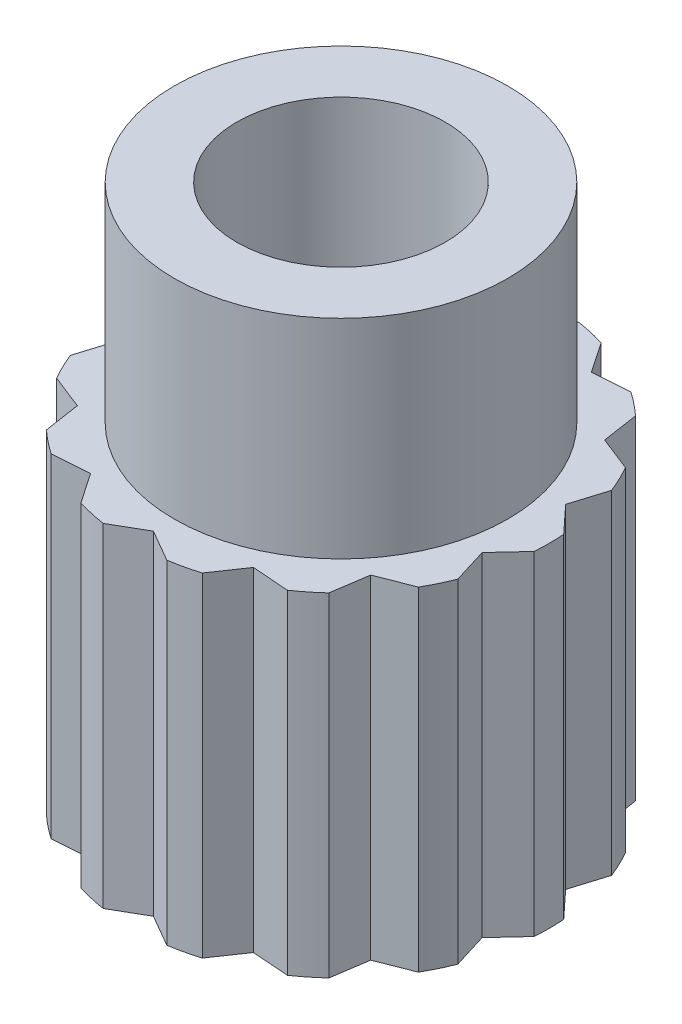
from build123d import *

# Parameters (mm, degrees)
MAINBODYS_R           = 2.5
MAIN_BODY_DEPTH       = 2
M3X0_5_TAPPED_HOLE1_D = 2.5
GROOVED_CUT_DEPTH     = 6.338539126
GC_START              = -2
GC_CP_DEPTH           = 4
PRESSFITBODYS_R       = 2
PRESSFITBODYS_R_2     = 1.25
PRESS_FIT_BODY_DEPTH  = 2.5


# Read off the part's stored shape, not the designer's step: GC CP
with BuildPart() as part:
    # MainBodyS → MAIN BODY (new, symmetric)
    with BuildSketch(Plane(origin=(0, 0, 0), x_dir=(1, 0, 0), z_dir=(0, 1, 0))):
        with Locations(Location((0, 0, 0), (0, 0, 270))):
            Circle(MAINBODYS_R)
    extrude(amount=MAIN_BODY_DEPTH, both=True)

    # M3x0.5 Tapped Hole1 (through all)
    with Locations(Plane(origin=(0, 2, 0), x_dir=(1, 0, 0), z_dir=(0, 1, 0))):
        with Locations((0, 0)):
            Hole(M3X0_5_TAPPED_HOLE1_D / 2)

    # GroovedCutS → GROOVED CUT (cut, through all)
    with BuildSketch(Plane(origin=(0, 2, 0), x_dir=(1, 0, 0), z_dir=(0, 1, 0))):
        with BuildLine():
            Line((0, 2.25), (0.382129822, 2.470622755))
            ThreePointArc((0.382129822, 2.470622755), (0, 2.5), (-0.382129822, 2.470622755))
            Line((-0.382129822, 2.470622755), (0, 2.25))
        make_face()
    extrude(amount=-GROOVED_CUT_DEPTH, mode=Mode.SUBTRACT)

    # GC CP outline → GC CP (cut)
    with BuildSketch(Plane(origin=(0, 0, 0), x_dir=(1, 0, 0), z_dir=(0, 1, 0)).offset(GC_START)):
        with BuildLine():
            ThreePointArc((-0.727675966, 2.391754103), (-1.084709348, 2.25242217), (-1.416250112, 2.060154271))
            Line((-1.416250112, 2.060154271), (-0.976238413, 2.027179953))
            Line((-0.976238413, 2.027179953), (-0.727675966, 2.391754103))
        make_face()
        with BuildLine():
            Line((0.976238413, 2.027179953), (1.416250112, 2.060154271))
            ThreePointArc((1.416250112, 2.060154271), (1.084709348, 2.25242217), (0.727675966, 2.391754103))
            Line((0.727675966, 2.391754103), (0.976238413, 2.027179953))
        make_face()
        with BuildLine():
            Line((1.759120836, 1.402852054), (2.169864698, 1.241646967))
            ThreePointArc((2.169864698, 1.241646967), (1.954578706, 1.558724504), (1.693356605, 1.839169217))
            Line((1.693356605, 1.839169217), (1.759120836, 1.402852054))
        make_face()
        with BuildLine():
            Line((2.193587802, 0.500672101), (2.493710969, 0.177216254))
            ThreePointArc((2.493710969, 0.177216254), (2.43731978, 0.556302335), (2.3236472, 0.922314312))
            Line((2.3236472, 0.922314312), (2.193587802, 0.500672101))
        make_face()
        with BuildLine():
            Line((2.193587802, -0.500672101), (2.3236472, -0.922314312))
            ThreePointArc((2.3236472, -0.922314312), (2.43731978, -0.556302335), (2.493710969, -0.177216254))
            Line((2.493710969, -0.177216254), (2.193587802, -0.500672101))
        make_face()
        with BuildLine():
            Line((1.759120836, -1.402852054), (1.693356605, -1.839169217))
            ThreePointArc((1.693356605, -1.839169217), (1.954578706, -1.558724504), (2.169864698, -1.241646967))
            Line((2.169864698, -1.241646967), (1.759120836, -1.402852054))
        make_face()
        with BuildLine():
            Line((0.976238413, -2.027179953), (0.727675966, -2.391754103))
            ThreePointArc((0.727675966, -2.391754103), (1.084709348, -2.25242217), (1.416250112, -2.060154271))
            Line((1.416250112, -2.060154271), (0.976238413, -2.027179953))
        make_face()
        with BuildLine():
            Line((0, -2.25), (-0.382129822, -2.470622755))
            ThreePointArc((-0.382129822, -2.470622755), (0, -2.5), (0.382129822, -2.470622755))
            Line((0.382129822, -2.470622755), (0, -2.25))
        make_face()
        with BuildLine():
            Line((-0.976238413, -2.027179953), (-1.416250112, -2.060154271))
            ThreePointArc((-1.416250112, -2.060154271), (-1.084709348, -2.25242217), (-0.727675966, -2.391754103))
            Line((-0.727675966, -2.391754103), (-0.976238413, -2.027179953))
        make_face()
        with BuildLine():
            Line((-1.759120836, -1.402852054), (-2.169864698, -1.241646967))
            ThreePointArc((-2.169864698, -1.241646967), (-1.954578706, -1.558724504), (-1.693356605, -1.839169217))
            Line((-1.693356605, -1.839169217), (-1.759120836, -1.402852054))
        make_face()
        with BuildLine():
            Line((-2.193587802, -0.500672101), (-2.493710969, -0.177216254))
            ThreePointArc((-2.493710969, -0.177216254), (-2.43731978, -0.556302335), (-2.3236472, -0.922314312))
            Line((-2.3236472, -0.922314312), (-2.193587802, -0.500672101))
        make_face()
        with BuildLine():
            Line((-2.193587802, 0.500672101), (-2.3236472, 0.922314312))
            ThreePointArc((-2.3236472, 0.922314312), (-2.43731978, 0.556302335), (-2.493710969, 0.177216254))
            Line((-2.493710969, 0.177216254), (-2.193587802, 0.500672101))
        make_face()
        with BuildLine():
            Line((-1.759120836, 1.402852054), (-1.693356605, 1.839169217))
            ThreePointArc((-1.693356605, 1.839169217), (-1.954578706, 1.558724504), (-2.169864698, 1.241646967))
            Line((-2.169864698, 1.241646967), (-1.759120836, 1.402852054))
        make_face()
    extrude(amount=GC_CP_DEPTH, mode=Mode.SUBTRACT)

    # PressFitBodyS → PRESS FIT BODY (add)
    with BuildSketch(Plane(origin=(0, 2, 0), x_dir=(1, 0, 0), z_dir=(0, 1, 0))):
        with Locations(Location((0, 0, 0), (0, 0, 270))):
            Circle(PRESSFITBODYS_R)
        with Locations(Location((0, 0, 0), (0, 0, 270))):
            Circle(PRESSFITBODYS_R_2, mode=Mode.SUBTRACT)
    extrude(amount=PRESS_FIT_BODY_DEPTH)


solid = part.part
